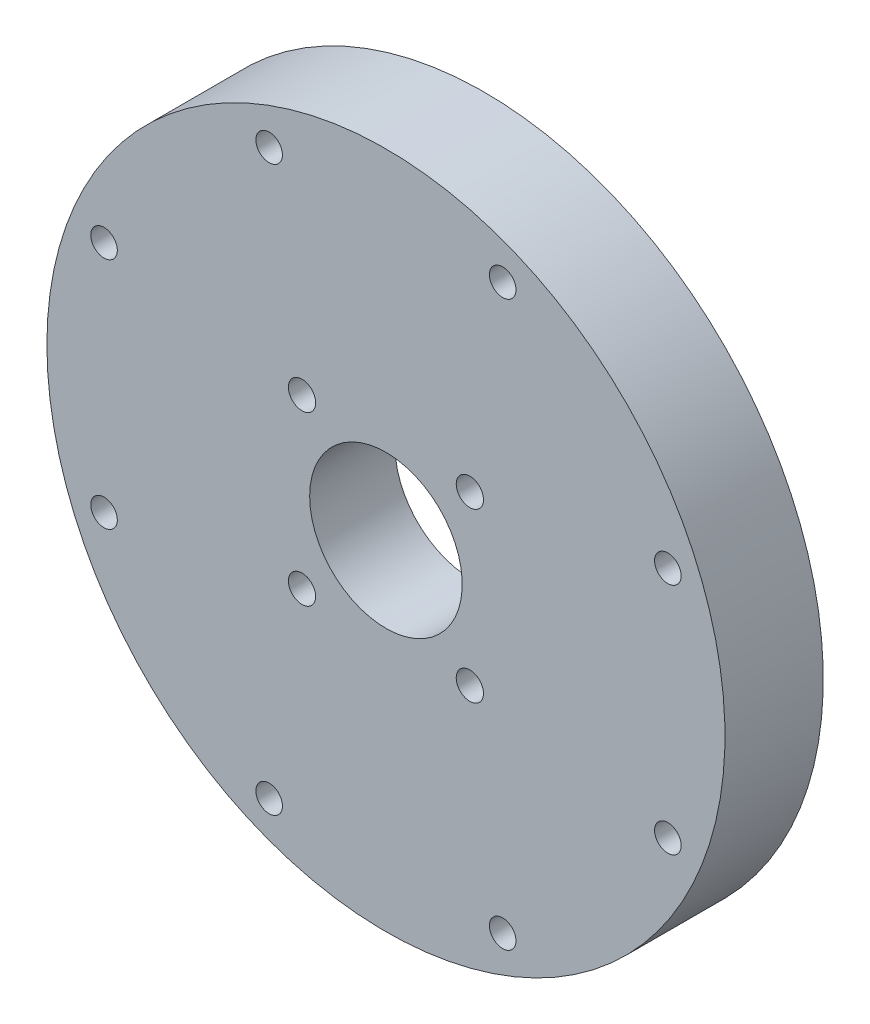
from build123d import *

# Parameters (mm, degrees)
SKETCH16_W                                      = 49.2125
SKETCH16_H                                      = 24.13
SKETCH18_R                                      = 63.5
VOLUTE_CUTOUT_DEPTH                             = 5.715
SKETCH4_R                                       = 2.4892
FASTENER_HOLE_DEPTH                             = 93.987939703
FASTENER_HOLES_COUNT                            = 8
SKETCH17_R                                      = 32.512
IMPELLER_CLEARANCE_DEPTH                        = 8.128
CBORE_FOR_10_SOCKET_HEAD_CAP_SCREW1_D           = 5.1054
CBORE_FOR_10_SOCKET_HEAD_CAP_SCREW1_CBORE_D     = 9.525
CBORE_FOR_10_SOCKET_HEAD_CAP_SCREW1_CBORE_DEPTH = 4.826
SKETCH21_R                                      = 50.8
SKETCH21_R_2                                    = 46.0248
CUT_EXTRUDE1_DEPTH                              = 3.1369


with BuildPart() as part:
    # Sketch16 → Main Body (revolve)
    with BuildSketch(Plane(origin=(0, 0, 0), x_dir=(1, 0, 0), z_dir=(0, 1, 0))):
        with Locations((38.89375, -12.065)):
            Rectangle(SKETCH16_W, SKETCH16_H)
    revolve(axis=Axis((0, 0, 0), (0, 0, 1)))

    # Sketch18 → Volute Cutout (cut)
    with BuildSketch(Plane(origin=(0, 0, 0), x_dir=(-1, 0, 0), z_dir=(0, 0, -1))):
        Circle(SKETCH18_R)
        with BuildLine():
            ThreePointArc((-44.763213962, 0), (-43.883034366, 2.328238698), (-41.593494633, 3.304670655))
            Line((-41.593494633, 3.304670655), (-38.338438787, 3.304670655))
            ThreePointArc((-38.338438787, 3.304670655), (-35.382102361, 4.389545114), (-33.829218893, 7.129149209))
            add(Edge.make_bspline(
                [(-33.829218893, 7.129149209), (-33.734655008, 7.700712878), (-33.516311109, 8.842034383), (-33.102704602, 10.538150267), (-32.602833338, 12.216692386), (-32.017965922, 13.871662747), (-31.349191468, 15.498755899), (-30.5978199, 17.093716034), (-29.765379241, 18.652348338), (-28.85361226, 20.170530201), (-27.864472781, 21.644222235), (-26.800121479, 23.069479109), (-25.662921186, 24.442460162), (-24.455431695, 25.759439779), (-23.180404062, 27.016817518), (-21.840774402, 28.21112794), (-20.439657201, 29.339050137), (-18.980338149, 30.397416931), (-17.466266506, 31.383223709), (-15.90104702, 32.293636882), (-14.288431416, 33.126001944), (-12.632309463, 33.877851098), (-10.936699661, 34.546910451), (-9.205739549, 35.131106723), (-7.443675663, 35.628573491), (-5.654853178, 36.037656917), (-3.84370524, 36.356920959), (-2.014742036, 36.585152051), (-0.172539606, 36.721363228), (1.678271559, 36.764797689), (3.533018111, 36.714931787), (5.3869956, 36.571477434), (7.235480366, 36.334383913), (9.07374153, 36.003839086), (10.897053062, 35.58027), (12.700705888, 35.064342878), (14.480020006, 34.456962497), (16.230356593, 33.759270957), (17.947130045, 32.972645827), (19.625819949, 32.098697681), (21.261982935, 31.139267032), (22.851264382, 30.096420656), (24.389409957, 28.972447316), (25.872276938, 27.769852906), (27.29584531, 26.491355013), (28.656228591, 25.139876909), (29.949684369, 23.718540989), (31.17262451, 22.230661674), (32.32162502, 20.679737787), (33.393435533, 19.069444419), (34.384988385, 17.40362431), (35.293407272, 15.686278765), (36.11601545, 13.921558115), (36.850343459, 12.113751764), (37.494136352, 10.267277823), (38.045360401, 8.38667238), (38.502209273, 6.476578416), (38.863109645, 4.541734393), (39.126726243, 2.586962555), (39.291966303, 0.617156959), (39.357983419, -1.362728731), (39.324180782, -3.347693652), (39.190213789, -5.332702333), (38.955992027, -7.312697422), (38.621680597, -9.282612528), (38.187700803, -11.23738514), (37.654730183, -13.171969596), (37.023701879, -15.081350059), (36.295803353, -16.960553479), (35.472474446, -18.804662496), (34.555404779, -20.608828259), (33.546530503, -22.368283123), (32.448030404, -24.078353194), (31.26232137, -25.734470685), (29.992053224, -27.332186055), (28.640102943, -28.867179894), (27.209568266, -30.335274533), (25.70376071, -31.732445327), (24.12619801, -33.054831606), (22.480595995, -34.298747245), (20.770859922, -35.460690836), (19.001075294, -36.537355425), (17.175498164, -37.525637795), (15.298544973, -38.422647266), (13.374781932, -39.225713982), (11.408913967, -39.93239668), (9.405773269, -40.540489886), (7.370307471, -41.048030557), (5.307567475, -41.453304115), (3.222694963, -41.754849874), (1.120909625, -41.951465843), (-0.992503863, -42.042212881), (-3.11220909, -42.026418195), (-5.232831344, -41.903678173), (-7.348971199, -41.673860539), (-9.455218223, -41.337105816), (-11.546164776, -40.893828104), (-13.616419848, -40.344715153), (-15.660622923, -39.690727741), (-17.673457812, -38.93309834), (-19.649666438, -38.073329092), (-21.584062524, -37.113189077), (-23.471545152, -36.054710891), (-25.307112165, -34.900186527), (-27.085873367, -33.652162581), (-28.803063488, -32.313434789), (-30.454054887, -30.887041888), (-32.034369952, -29.376258848), (-33.539693165, -27.784589454), (-34.9658828, -26.115758288), (-36.30898223, -24.373702093), (-37.565230795, -22.562560578), (-38.731074224, -20.686666652), (-39.803174556, -18.750536124), (-40.778419563, -16.758856904), (-41.653931621, -14.716477704), (-42.427076016, -12.628396291), (-43.09546867, -10.499747309), (-43.656983249, -8.335789696), (-44.109757635, -6.141893742), (-44.437890089, -4.016226935), (-44.606204477, -2.433517734), (-44.678884826, -1.499236103), (-44.704449619, -1.124895611), (-44.721871029, -0.843919777), (-44.737493089, -0.562768038), (-44.751475519, -0.281457909), (-44.759300821, -0.093827142), (-44.763213962, 0)],
                knots=[0.028896694, 0.028896694, 0.028896694, 0.028896694, 0.0359159, 0.042971309, 0.050042349, 0.057129073, 0.064231529, 0.071349764, 0.078483823, 0.085633747, 0.092799578, 0.099981356, 0.107179117, 0.1143929, 0.121622741, 0.128868673, 0.136130732, 0.14340895, 0.15070336, 0.158013994, 0.165340883, 0.172684057, 0.180043546, 0.18741938, 0.194811587, 0.202220196, 0.209645235, 0.217086731, 0.224544712, 0.232019203, 0.239510231, 0.247017823, 0.254542004, 0.262082798, 0.269640231, 0.277214328, 0.284805113, 0.29241261, 0.300036843, 0.307677836, 0.31533561, 0.323010191, 0.3307016, 0.338409861, 0.346134995, 0.353877025, 0.361635972, 0.369411859, 0.377204707, 0.385014537, 0.392841372, 0.40068523, 0.408546135, 0.416424105, 0.424319163, 0.432231327, 0.440160619, 0.448107058, 0.456070665, 0.464051459, 0.47204946, 0.480064687, 0.48809716, 0.496146898, 0.50421392, 0.512298245, 0.520399892, 0.52851888, 0.536655227, 0.544808952, 0.552980073, 0.561168609, 0.569374578, 0.577597998, 0.585838887, 0.594097262, 0.602373142, 0.610666545, 0.618977488, 0.627305988, 0.635652063, 0.64401573, 0.652397007, 0.66079591, 0.669212457, 0.677646665, 0.686098551, 0.694568131, 0.703055422, 0.711560441, 0.720083205, 0.728623729, 0.737182031, 0.745758127, 0.754352033, 0.762963766, 0.771593341, 0.780240774, 0.788906083, 0.797589282, 0.806290387, 0.815009415, 0.823746381, 0.8325013, 0.841274189, 0.850065063, 0.858873938, 0.867700829, 0.876545751, 0.885408719, 0.89428975, 0.903188858, 0.912106059, 0.921041367, 0.929994798, 0.938966366, 0.947956087, 0.956963975, 0.965990046, 0.975034314, 0.984096794, 0.992041415, 0.994313871, 0.995450526, 0.996587467, 0.997724693, 0.998862204, 1, 1, 1, 1], degree=3))
        make_face(mode=Mode.SUBTRACT)
    extrude(amount=-VOLUTE_CUTOUT_DEPTH, mode=Mode.SUBTRACT)

    # Sketch4 → Fastener Hole (cut, through all)
    with BuildSketch(Plane.XY.offset(24.13)):
        with Locations((52.799715283, -21.87035816)):
            Circle(SKETCH4_R)
    fastener_hole = extrude(amount=-FASTENER_HOLE_DEPTH, mode=Mode.SUBTRACT)

    # Fastener Holes: Fastener Hole ×8 about axis
    fastener_holes_axis = Axis((0, 0, 0), (0, 0, -1))
    for i in range(1, FASTENER_HOLES_COUNT):
        add(fastener_hole.rotate(fastener_holes_axis, i * 360 / FASTENER_HOLES_COUNT), mode=Mode.SUBTRACT)

    # Sketch17 → Impeller Clearance (cut)
    with BuildSketch(Plane(origin=(0, 0, 0), x_dir=(-1, 0, 0), z_dir=(0, 0, -1))):
        Circle(SKETCH17_R)
    extrude(amount=-IMPELLER_CLEARANCE_DEPTH, mode=Mode.SUBTRACT)

    # CBORE for #10 Socket Head Cap Screw1 (through all)
    with Locations(Plane(origin=(15.715448212, -15.715448212, 8.128), x_dir=(-1, 0, 0), z_dir=(0, 0, -1))):
        with Locations((0, 0), (0, 31.430896424), (31.430896424, 31.430896424), (31.430896424, 0)):
            CounterBoreHole(CBORE_FOR_10_SOCKET_HEAD_CAP_SCREW1_D / 2, CBORE_FOR_10_SOCKET_HEAD_CAP_SCREW1_CBORE_D / 2, CBORE_FOR_10_SOCKET_HEAD_CAP_SCREW1_CBORE_DEPTH)

    # Sketch21 → Cut-Extrude1 (cut)
    with BuildSketch(Plane(origin=(0, 0, 5.715), x_dir=(-1, 0, 0), z_dir=(0, 0, -1))):
        Circle(SKETCH21_R)
        Circle(SKETCH21_R_2, mode=Mode.SUBTRACT)
    extrude(amount=-CUT_EXTRUDE1_DEPTH, mode=Mode.SUBTRACT)


solid = part.part
